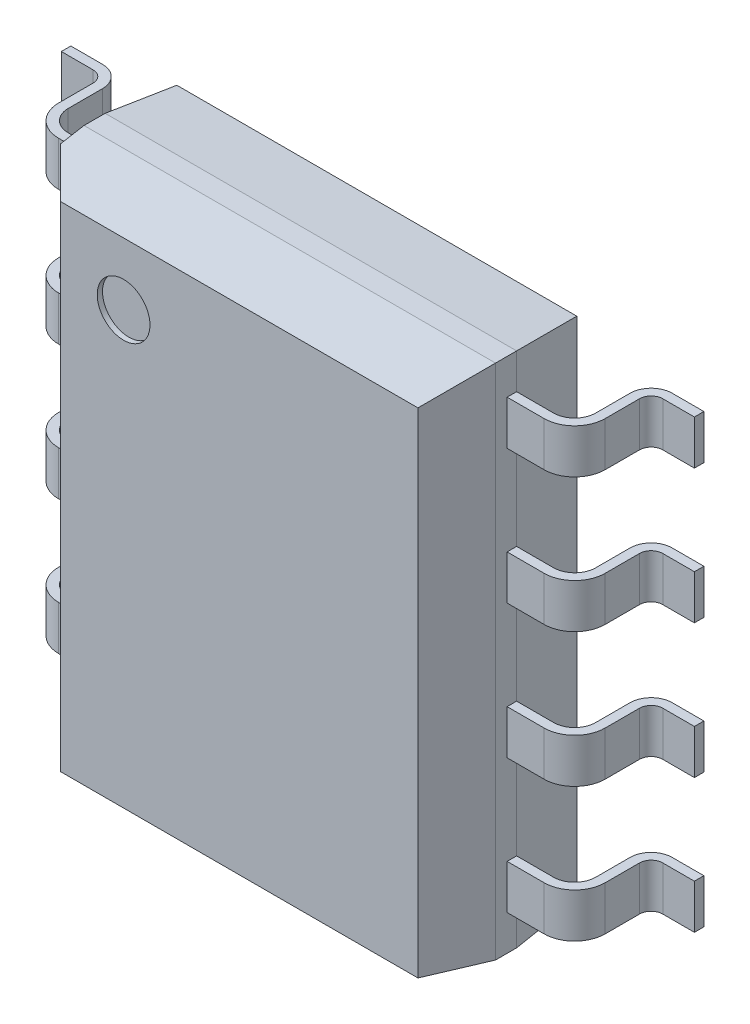
from build123d import *
from OCP.BRepFilletAPI import BRepFilletAPI_MakeChamfer

# Parameters (mm, degrees)
ESQUISSE2_W              = 3.9
ESQUISSE2_H              = 4.9
CORP_DEPTH               = 1.45
PIN_1_DEPTH              = 0.21
R_P_TITION_PIN_1_4_COUNT = 4
R_P_TITION_PIN_1_4_PITCH = 1.27
SYM_TRIE1_COPY_1_DEPTH   = 0.21
SYM_TRIE1_COPY_2_DEPTH   = 0.21
SYM_TRIE1_COPY_3_DEPTH   = 0.21
CHANFREIN4_SIZE          = 0.625
CHANFREIN4_SIZE2         = 0.110204363
CHANFREIN5_SIZE          = 0.625
CHANFREIN5_SIZE_2        = 0.054680415
ESQUISSE8_R              = 0.25
ENL_V_MAT_EXTRU_1_DEPTH  = 0.05
CHANFREIN7_SIZE          = 0.4
ESQUISSE9_W              = 2.1
ESQUISSE9_H              = 2.1
EXPOSED_PAD_DEPTH        = 0.1


with BuildPart() as part:
    # Esquisse2 → corp (new body)
    with BuildSketch(Plane.XY.offset(0.1)):
        Rectangle(ESQUISSE2_W, ESQUISSE2_H)
    extrude(amount=CORP_DEPTH)

    # Esquisse6 → pin 1 (add, symmetric)
    with BuildSketch(Plane(origin=(0, 1.905, 0), x_dir=(-1, 0, 0), z_dir=(0, 1, 0))):
        with BuildLine():
            Line((1.95, 0.725), (2.3, 0.725))
            ThreePointArc((2.3, 0.725), (2.441421356, 0.666421356), (2.5, 0.525))
            Line((2.5, 0.525), (2.5, 0.2))
            ThreePointArc((2.5, 0.2), (2.558578644, 0.058578644), (2.7, 0))
            Line((2.7, 0), (3, 0))
            Line((3, 0), (3, 0.09))
            Line((3, 0.09), (2.7, 0.09))
            ThreePointArc((2.7, 0.09), (2.622218254, 0.122218254), (2.59, 0.2))
            Line((2.59, 0.2), (2.59, 0.525))
            ThreePointArc((2.59, 0.525), (2.505060967, 0.730060967), (2.3, 0.815))
            Line((2.3, 0.815), (1.95, 0.815))
            Line((1.95, 0.815), (1.95, 0.725))
        make_face()
    pin_1 = extrude(amount=PIN_1_DEPTH, both=True)

    # Répétition pin 1-4: pin 1 ×4
    with Locations(*[(0, -i * R_P_TITION_PIN_1_4_PITCH, 0) for i in range(1, R_P_TITION_PIN_1_4_COUNT)]):
        add(pin_1)

    # Symétrie1: pin 1 across plane
    add(pin_1.mirror(Plane(origin=(0, 0, 0), x_dir=(0, 0, 1), z_dir=(1, 0, 0))))

    # Symétrie1 copy 1 sketch → Symétrie1 copy 1 (add, symmetric)
    with BuildSketch(Plane(origin=(0, 0.635, 0), x_dir=(1, 0, 0), z_dir=(0, 1, 0))):
        with BuildLine():
            Line((1.95, -0.725), (2.3, -0.725))
            ThreePointArc((2.3, -0.725), (2.441421356, -0.666421356), (2.5, -0.525))
            Line((2.5, -0.525), (2.5, -0.2))
            ThreePointArc((2.5, -0.2), (2.558578644, -0.058578644), (2.7, 0))
            Line((2.7, 0), (3, 0))
            Line((3, 0), (3, -0.09))
            Line((3, -0.09), (2.7, -0.09))
            ThreePointArc((2.7, -0.09), (2.622218254, -0.122218254), (2.59, -0.2))
            Line((2.59, -0.2), (2.59, -0.525))
            ThreePointArc((2.59, -0.525), (2.505060967, -0.730060967), (2.3, -0.815))
            Line((2.3, -0.815), (1.95, -0.815))
            Line((1.95, -0.815), (1.95, -0.725))
        make_face()
    extrude(amount=SYM_TRIE1_COPY_1_DEPTH, both=True)

    # Symétrie1 copy 2 sketch → Symétrie1 copy 2 (add, symmetric)
    with BuildSketch(Plane(origin=(0, -0.635, 0), x_dir=(1, 0, 0), z_dir=(0, 1, 0))):
        with BuildLine():
            Line((1.95, -0.725), (2.3, -0.725))
            ThreePointArc((2.3, -0.725), (2.441421356, -0.666421356), (2.5, -0.525))
            Line((2.5, -0.525), (2.5, -0.2))
            ThreePointArc((2.5, -0.2), (2.558578644, -0.058578644), (2.7, 0))
            Line((2.7, 0), (3, 0))
            Line((3, 0), (3, -0.09))
            Line((3, -0.09), (2.7, -0.09))
            ThreePointArc((2.7, -0.09), (2.622218254, -0.122218254), (2.59, -0.2))
            Line((2.59, -0.2), (2.59, -0.525))
            ThreePointArc((2.59, -0.525), (2.505060967, -0.730060967), (2.3, -0.815))
            Line((2.3, -0.815), (1.95, -0.815))
            Line((1.95, -0.815), (1.95, -0.725))
        make_face()
    extrude(amount=SYM_TRIE1_COPY_2_DEPTH, both=True)

    # Symétrie1 copy 3 sketch → Symétrie1 copy 3 (add, symmetric)
    with BuildSketch(Plane(origin=(0, -1.905, 0), x_dir=(1, 0, 0), z_dir=(0, 1, 0))):
        with BuildLine():
            Line((1.95, -0.725), (2.3, -0.725))
            ThreePointArc((2.3, -0.725), (2.441421356, -0.666421356), (2.5, -0.525))
            Line((2.5, -0.525), (2.5, -0.2))
            ThreePointArc((2.5, -0.2), (2.558578644, -0.058578644), (2.7, 0))
            Line((2.7, 0), (3, 0))
            Line((3, 0), (3, -0.09))
            Line((3, -0.09), (2.7, -0.09))
            ThreePointArc((2.7, -0.09), (2.622218254, -0.122218254), (2.59, -0.2))
            Line((2.59, -0.2), (2.59, -0.525))
            ThreePointArc((2.59, -0.525), (2.505060967, -0.730060967), (2.3, -0.815))
            Line((2.3, -0.815), (1.95, -0.815))
            Line((1.95, -0.815), (1.95, -0.725))
        make_face()
    extrude(amount=SYM_TRIE1_COPY_3_DEPTH, both=True)

    # Chanfrein4: one chamfer whose edges measure the first distance from different faces: ONE call of the kernel's chamfer builder (chamfer() names one face for all edges)
    chanfrein4_edges_1 = [part.edges().sort_by_distance(p)[0] for p in [
        (1.95, 0, 1.55),
    ]]
    chanfrein4_side_1 = [part.faces().sort_by_distance(p)[0] for p in [
        (1.95, 0, 0.826195893),
    ]]
    chanfrein4_edges_2 = [part.edges().sort_by_distance(p)[0] for p in [
        (0, 2.45, 1.55),
    ]]
    chanfrein4_side_2 = [part.faces().sort_by_distance(p)[0] for p in [
        (0, 2.45, 0.825),
    ]]
    chanfrein4_edges_3 = [part.edges().sort_by_distance(p)[0] for p in [
        (0, -2.45, 1.55),
    ]]
    chanfrein4_side_3 = [part.faces().sort_by_distance(p)[0] for p in [
        (0, -2.45, 0.825),
    ]]
    chanfrein4 = BRepFilletAPI_MakeChamfer(part.part.solid().wrapped)
    for e in chanfrein4_edges_1:
        chanfrein4.Add(CHANFREIN4_SIZE, CHANFREIN4_SIZE2, e.wrapped, chanfrein4_side_1[0].wrapped)  # the first distance lies on this face
    for e in chanfrein4_edges_2:
        chanfrein4.Add(CHANFREIN4_SIZE, CHANFREIN4_SIZE2, e.wrapped, chanfrein4_side_2[0].wrapped)  # the first distance lies on this face
    for e in chanfrein4_edges_3:
        chanfrein4.Add(CHANFREIN4_SIZE, CHANFREIN4_SIZE2, e.wrapped, chanfrein4_side_3[0].wrapped)  # the first distance lies on this face
    add(Compound.cast(chanfrein4.Shape()), mode=Mode.REPLACE)

    # Chanfrein5
    chanfrein5_edges_1 = [part.edges().sort_by_distance(p)[0] for p in [
        (0, 2.45, 0.1),
    ]]
    chanfrein5_side_1 = [part.faces().sort_by_distance(p)[0] for p in [
        (0, 2.45, 0.101093608),
    ]]
    chanfrein5_edges_2 = [part.edges().sort_by_distance(p)[0] for p in [
        (1.95, 0, 0.1),
    ]]
    chanfrein5_side_2 = [part.faces().sort_by_distance(p)[0] for p in [
        (1.948906392, 0, 0.1),
    ]]
    chanfrein5_edges_3 = [part.edges().sort_by_distance(p)[0] for p in [
        (0, -2.45, 0.1),
    ]]
    chanfrein5_side_3 = [part.faces().sort_by_distance(p)[0] for p in [
        (0, -2.448906392, 0.1),
    ]]
    chanfrein5_edges_4 = [part.edges().sort_by_distance(p)[0] for p in [
        (-1.95, 0, 0.1),
    ]]
    chanfrein5_side_4 = [part.faces().sort_by_distance(p)[0] for p in [
        (-1.95, 0, 0.101093608),
    ]]
    chanfrein5 = BRepFilletAPI_MakeChamfer(part.part.solid().wrapped)
    for e in chanfrein5_edges_1:
        chanfrein5.Add(CHANFREIN5_SIZE - 0.0001, CHANFREIN5_SIZE_2 - 0.0001, e.wrapped, chanfrein5_side_1[0].wrapped)
    for e in chanfrein5_edges_2:
        chanfrein5.Add(CHANFREIN5_SIZE_2 - 0.0001, CHANFREIN5_SIZE - 0.0001, e.wrapped, chanfrein5_side_2[0].wrapped)
    for e in chanfrein5_edges_3:
        chanfrein5.Add(CHANFREIN5_SIZE_2 - 0.0001, CHANFREIN5_SIZE - 0.0001, e.wrapped, chanfrein5_side_3[0].wrapped)
    for e in chanfrein5_edges_4:
        chanfrein5.Add(CHANFREIN5_SIZE - 0.0001, CHANFREIN5_SIZE_2 - 0.0001, e.wrapped, chanfrein5_side_4[0].wrapped)
    add(Compound.cast(chanfrein5.Shape()), mode=Mode.REPLACE)  # a hair under: the kernel refuses the full size

    # Esquisse8 → Enlèv. mat.-Extru.1 (cut)
    with BuildSketch(Plane.XY.offset(1.55)):
        with Locations((-0.95, 1.75)):
            Circle(ESQUISSE8_R)
    extrude(amount=-ENL_V_MAT_EXTRU_1_DEPTH, mode=Mode.SUBTRACT)

    # Chanfrein7
    chanfrein7_edges = [part.edges().sort_by_distance(p)[0] for p in [
        (-1.95, 0, 1.55),
    ]]
    chamfer(chanfrein7_edges, length=CHANFREIN7_SIZE)

    # Esquisse9 → exposed pad (add)
    with BuildSketch(Plane(origin=(0, 0, 0.1), x_dir=(-1, 0, 0), z_dir=(0, 0, -1))):
        Rectangle(ESQUISSE9_W, ESQUISSE9_H)
    extrude(amount=EXPOSED_PAD_DEPTH)


solid = part.part
